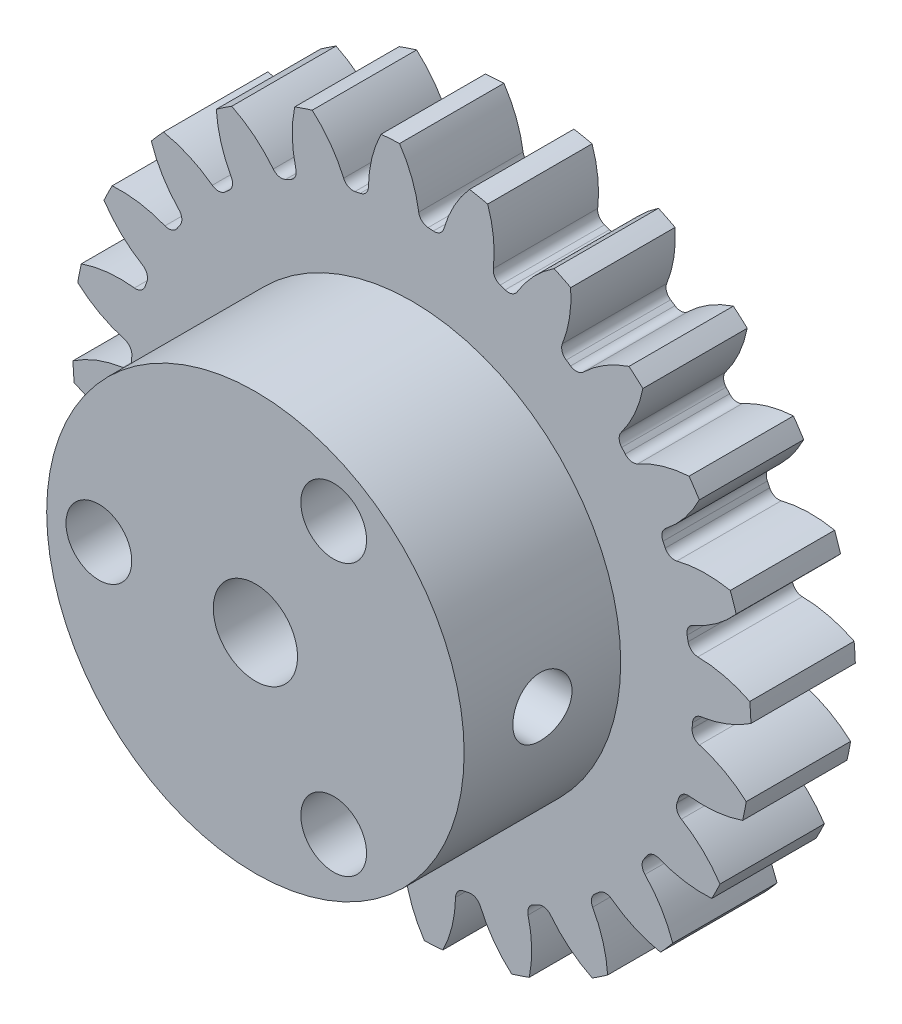
from build123d import *

# Parameters (mm, degrees)
SKETCH3_R           = 20.6375
GEARBODY_DEPTH      = 6.35
TOOTHCUT_DEPTH      = 30.868634259
CIRPATTERN1_COUNT   = 24
HUB2DIA_R           = 12.7
BOSS_EXTRUDE1_DEPTH = 9.525
SKETCH4_R           = 2.000000064
CUT_EXTRUDE1_DEPTH  = 34.206692975
SKETCH5_R           = 2.563499953
CUT_EXTRUDE2_DEPTH  = 34.206692975
SKETCH6_R           = 1.799999956
CUT_EXTRUDE3_DEPTH  = 34.206692975


with BuildPart() as part:
    # Sketch3 → gearBody (new body)
    with BuildSketch(Plane.XY):
        Circle(SKETCH3_R)
    extrude(amount=GEARBODY_DEPTH)

    # Sketch2 → toothCut (cut, through all)
    with BuildSketch(Plane.XY):
        with BuildLine():
            ThreePointArc((17.04439181, -1.303986765), (17.05590718, -1.14354882), (17.065912391, -0.983009622))
            ThreePointArc((17.065912391, -0.983009622), (17.226475942, -0.603092534), (17.591114308, -0.410332293))
            ThreePointArc((17.591114308, -0.410332293), (20.42378314, 0.626979823), (22.599606758, 2.716434472))
            ThreePointArc((22.599606758, 2.716434472), (22.711286815, -1.522725526), (22.034703624, -5.709034773))
            ThreePointArc((22.034703624, -5.709034773), (20.157284273, -3.347822008), (17.488443939, -1.941649751))
            ThreePointArc((17.488443939, -1.941649751), (17.152801577, -1.701937731), (17.04439181, -1.303986765))
        make_face()
    toothcut = extrude(amount=TOOTHCUT_DEPTH, mode=Mode.SUBTRACT)

    # CirPattern1: toothCut ×24 about axis
    cirpattern1_axis = Axis((0, 0, 6.35), (0, 0, -1))
    for i in range(1, CIRPATTERN1_COUNT):
        add(toothcut.rotate(cirpattern1_axis, i * 360 / CIRPATTERN1_COUNT), mode=Mode.SUBTRACT)

    # hub2Dia → Boss-Extrude1 (add)
    with BuildSketch(Plane.XY.offset(6.35)):
        Circle(HUB2DIA_R)
    extrude(amount=BOSS_EXTRUDE1_DEPTH)

    # Sketch4 → Cut-Extrude1 (cut, through all)
    with BuildSketch(Plane(origin=(0, 0, 0), x_dir=(-1, 0, 0), z_dir=(0, 0, -1))):
        with Locations((9.525, 0)):
            Circle(SKETCH4_R)
        with Locations((-4.7625, -8.248891971)):
            Circle(SKETCH4_R)
        with Locations((-4.7625, 8.248891971)):
            Circle(SKETCH4_R)
    extrude(amount=-CUT_EXTRUDE1_DEPTH, mode=Mode.SUBTRACT)

    # Sketch5 → Cut-Extrude2 (cut, through all)
    with BuildSketch(Plane(origin=(0, 0, 0), x_dir=(-1, 0, 0), z_dir=(0, 0, -1))):
        Circle(SKETCH5_R)
    extrude(amount=-CUT_EXTRUDE2_DEPTH, mode=Mode.SUBTRACT)

    # Sketch6 → Cut-Extrude3 (cut, through all)
    with BuildSketch(Plane(origin=(0, 0, 0), x_dir=(0, 0, -1), z_dir=(1, 0, 0))):
        with Locations((-11.1125, 0)):
            Circle(SKETCH6_R)
    extrude(amount=CUT_EXTRUDE3_DEPTH, mode=Mode.SUBTRACT)


solid = part.part
